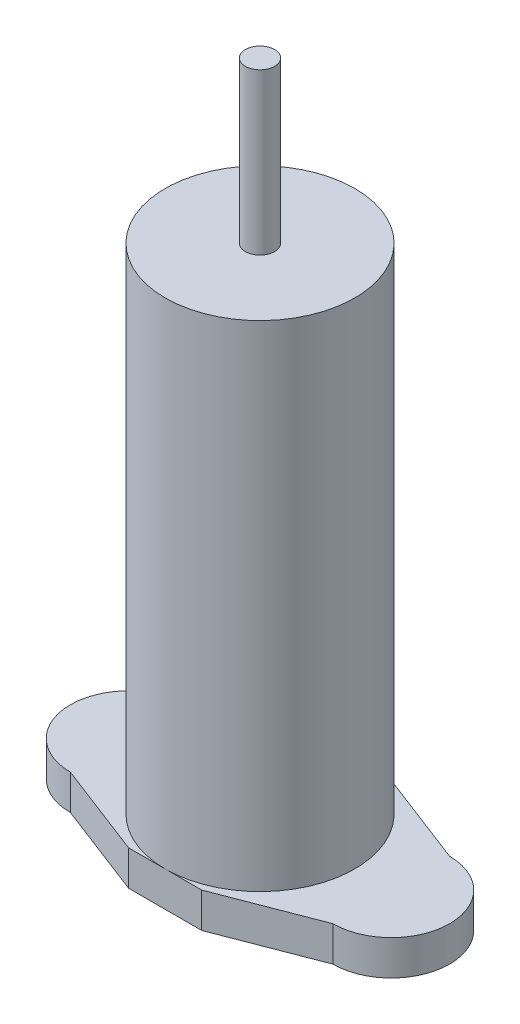
from build123d import *

# Parameters (mm, degrees)
EXTRUDE_1_DEPTH = 2.4
SKETCH_1_3_R    = 6.5
EXTRUDE_2_DEPTH = 36.3
SKETCH_2_R      = 1
EXTRUDE_3_DEPTH = 11


with BuildPart() as part:
    # Эскиз1 → Бобышка-Вытянуть1 (new body)
    with BuildSketch(Plane(origin=(0, 0, 0), x_dir=(1, 0, 0), z_dir=(0, 1, 0))):
        with BuildLine():
            Line((-2.505637153, 6.5), (-9, 4))
            ThreePointArc((-9, 4), (-13, 0), (-9, -4))
            Line((-9, -4), (-2.505637153, -6.5))
            Line((-2.505637153, -6.5), (2.505637153, -6.5))
            Line((2.505637153, -6.5), (9, -4))
            ThreePointArc((9, -4), (13, 0), (9, 4))
            Line((9, 4), (2.505637153, 6.5))
            Line((2.505637153, 6.5), (-2.505637153, 6.5))
        make_face()
    extrude(amount=EXTRUDE_1_DEPTH)

    # Эскиз1<3> → Бобышка-Вытянуть2 (add)
    with BuildSketch(Plane(origin=(0, 0, 0), x_dir=(1, 0, 0), z_dir=(0, 1, 0))):
        Circle(SKETCH_1_3_R)
    extrude(amount=EXTRUDE_2_DEPTH)

    # Эскиз2 → Бобышка-Вытянуть3 (add)
    with BuildSketch(Plane(origin=(0, 36.3, 0), x_dir=(1, 0, 0), z_dir=(0, 1, 0))):
        Circle(SKETCH_2_R)
    extrude(amount=EXTRUDE_3_DEPTH)


solid = part.part
